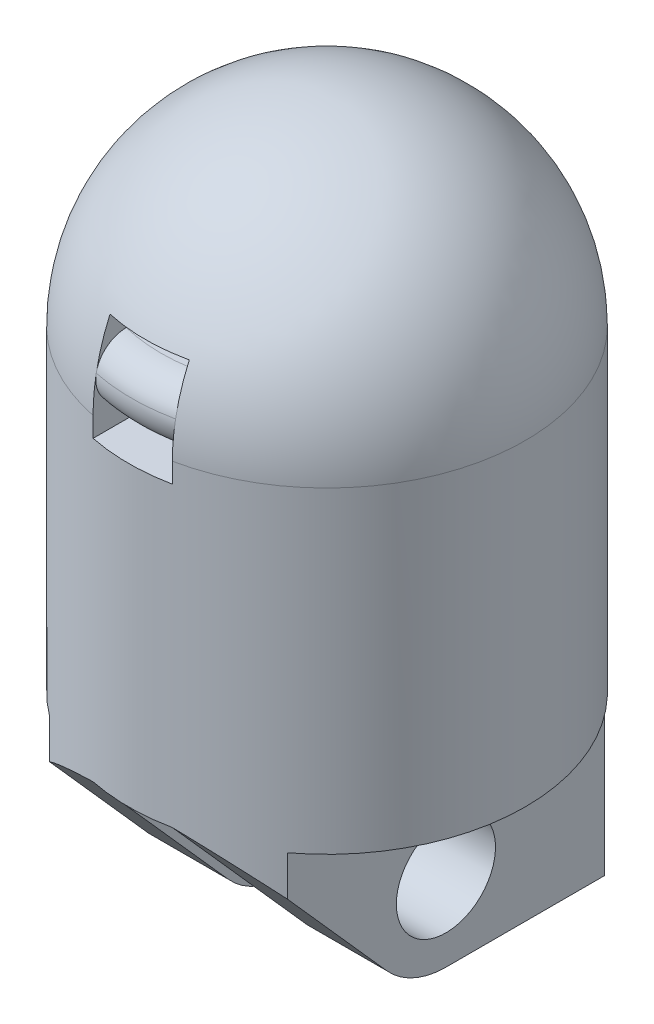
from build123d import *

# Parameters (mm, degrees)
CUT_EXTRUDE1_DEPTH      = 11.43
SKETCH3_R               = 3.175
CUT_EXTRUDE2_DEPTH      = 51.497474194
CUT_EXTRUDE3_DEPTH      = 48.941448664
CUT_EXTRUDE3_DEPTH_BACK = 48.941448664
SKETCH4_W               = 5.08
SKETCH4_H               = 1.27
FILLET1_R               = 1.905


with BuildPart() as part:
    # Sketch1 → Revolve1 (revolve)
    with BuildSketch(Plane.XY, mode=Mode.PRIVATE) as revolve1_sk:
        with BuildLine():
            Line((0, 0), (0, 5.602635041))
            Line((0, 5.602635041), (-2.54, 5.602635041))
            Line((-2.54, 5.602635041), (-2.54, 36.83))
            Line((-2.54, 36.83), (0, 36.83))
            Line((0, 36.83), (0, 44.45))
            ThreePointArc((0, 44.45), (-8.980256121, 40.730256121), (-12.7, 31.75))
            Line((-12.7, 31.75), (-12.7, 0))
            Line((-12.7, 0), (0, 0))
        make_face()
    revolve(revolve1_sk.sketch.rotate(Axis((0, 0, 0), (0, 1, 0)), 270), axis=Axis((0, 0, 0), (0, 1, 0)))

    # Sketch2 → Cut-Extrude1 (cut)
    with BuildSketch(Plane.XZ):
        with BuildLine():
            Line((-2.54, 12.443407893), (-2.54, -12.443407893))
            ThreePointArc((-2.54, -12.443407893), (0, -12.7), (2.54, -12.443407893))
            Line((2.54, -12.443407893), (2.54, 12.443407893))
            ThreePointArc((2.54, 12.443407893), (0, 12.7), (-2.54, 12.443407893))
        make_face()
        with BuildLine():
            Line((-7.62, 10.16), (-7.62, -10.16))
            ThreePointArc((-7.62, -10.16), (-12.7, 0), (-7.62, 10.16))
        make_face()
        with BuildLine():
            Line((7.62, 10.16), (7.62, -10.16))
            ThreePointArc((7.62, -10.16), (12.7, 0), (7.62, 10.16))
        make_face()
    extrude(amount=-CUT_EXTRUDE1_DEPTH, mode=Mode.SUBTRACT)

    # Sketch3 → Cut-Extrude2 (cut, through all)
    with BuildSketch(Plane.ZY.offset(7.62)):
        with Locations((0, 5.08)):
            Circle(SKETCH3_R)
        with BuildLine():
            Line((0, 0), (12.443407893, 0))
            Line((12.443407893, 0), (12.443407893, 11.43))
            Line((12.443407893, 11.43), (3.796422114, 1.704562379))
            ThreePointArc((3.796422114, 1.704562379), (2.080766311, 0.445691901), (0, 0))
        make_face()
    extrude(amount=-CUT_EXTRUDE2_DEPTH, mode=Mode.SUBTRACT)

    # Sketch4 → Cut-Extrude3 (cut, two sides: drawn at the far end of the back side and taken through both)
    with BuildSketch(Plane.XY.offset(-CUT_EXTRUDE3_DEPTH_BACK)):
        with Locations((0, 31.115)):
            Rectangle(SKETCH4_W, SKETCH4_H)
        with Locations((0, 36.195)):
            Rectangle(SKETCH4_W, SKETCH4_H)
    extrude(amount=CUT_EXTRUDE3_DEPTH + CUT_EXTRUDE3_DEPTH_BACK, mode=Mode.SUBTRACT)

    # Fillet1
    # the kernel refuses this fillet: 1.905 mm, written as the material it takes off along each edge
    with BuildSketch(Plane(origin=(0, 31.75, 0), x_dir=(-0.6006287696946434, 0, 0.7995280364159214), z_dir=(-0.7995280364159214, 0, -0.6006287696946434))) as fillet1_piece_1_section:
        with BuildLine():
            CenterArc((10.625582337, 1.905), FILLET1_R, 270, 100.164248622)
            Line((10.625582337, 0), (12.7, 0))
            ThreePointArc((12.7, 0), (12.650073138, 1.125010933), (12.500685102, 2.241176471))
        make_face()
    fillet1_piece_1 = revolve(axis=Axis((0, 31.75, 0), (0, 1, 0)), revolution_arc=73.829886486, mode=Mode.PRIVATE)
    fillet1_piece_1 = split(fillet1_piece_1, bisect_by=Plane(origin=(-2.54, 32.266908465, 12.1243087), z_dir=(1, 0, 0)), keep=Keep.TOP, mode=Mode.PRIVATE)
    fillet1_piece_1 = split(fillet1_piece_1, bisect_by=Plane(origin=(2.54, 32.266908465, 12.1243087), z_dir=(-1, 0, 0)), keep=Keep.TOP, mode=Mode.PRIVATE)
    add(fillet1_piece_1, mode=Mode.SUBTRACT)
    with BuildSketch(Plane(origin=(0, 35.56, 0), x_dir=(0.5180820301307622, 0, 0.8553309359865267), z_dir=(0.8553309359865267, 0, -0.5180820301307622))) as fillet1_piece_2_section:
        with BuildLine():
            CenterArc((10.625582337, 1.905), FILLET1_R, 270, 79.835751378)
            Line((10.625582337, 0), (12.115027858, 0))
            ThreePointArc((12.115027858, 0), (12.332827452, 0.778273257), (12.500685102, 1.568823529))
        make_face()
    fillet1_piece_2 = revolve(axis=Axis((0, 35.56, 0), (0, -1, 0)), revolution_arc=62.407371172, mode=Mode.PRIVATE)
    fillet1_piece_2 = split(fillet1_piece_2, bisect_by=Plane(origin=(-2.54, 35.21222625, 11.799196002), z_dir=(1, 0, 0)), keep=Keep.TOP, mode=Mode.PRIVATE)
    fillet1_piece_2 = split(fillet1_piece_2, bisect_by=Plane(origin=(2.54, 35.21222625, 11.799196002), z_dir=(-1, 0, 0)), keep=Keep.TOP, mode=Mode.PRIVATE)
    add(fillet1_piece_2, mode=Mode.SUBTRACT)
    with BuildSketch(Plane(origin=(0, 35.56, 0), x_dir=(0, 0, -1), z_dir=(-1, 0, 0))) as fillet1_piece_3_section:
        with BuildLine():
            CenterArc((10.625582337, 1.905), FILLET1_R, 270, 79.835751378)
            Line((10.625582337, 0), (12.115027858, 0))
            ThreePointArc((12.115027858, 0), (12.332827452, 0.778273257), (12.500685102, 1.568823529))
        make_face()
    fillet1_piece_3 = revolve(axis=Axis((0, 35.56, 0), (0, -1, 0)), revolution_arc=31.203269463, mode=Mode.PRIVATE)
    fillet1_piece_3 = split(fillet1_piece_3, bisect_by=Plane(origin=(2.54, 35.212226268, -11.799195909), z_dir=(-1, 0, 0)), keep=Keep.TOP, mode=Mode.PRIVATE)
    add(fillet1_piece_3, mode=Mode.SUBTRACT)
    with BuildSketch(Plane(origin=(0, 31.75, 0), x_dir=(0, 0, -1), z_dir=(1, 0, 0))) as fillet1_piece_4_section:
        with BuildLine():
            CenterArc((10.625582337, 1.905), FILLET1_R, 270, 100.164248622)
            Line((10.625582337, 0), (12.7, 0))
            ThreePointArc((12.7, 0), (12.650073138, 1.125010933), (12.500685102, 2.241176471))
        make_face()
    fillet1_piece_4 = revolve(axis=Axis((0, 31.75, 0), (0, 1, 0)), revolution_arc=36.914440828, mode=Mode.PRIVATE)
    fillet1_piece_4 = split(fillet1_piece_4, bisect_by=Plane(origin=(-2.54, 32.26690841, -12.124308672), z_dir=(1, 0, 0)), keep=Keep.TOP, mode=Mode.PRIVATE)
    add(fillet1_piece_4, mode=Mode.SUBTRACT)
    with BuildSketch(Plane(origin=(0, 31.75, 0), x_dir=(0.6006217587640484, 0, -0.799533303183289), z_dir=(0.799533303183289, 0, 0.6006217587640484))) as fillet1_piece_5_section:
        with BuildLine():
            CenterArc((10.625582337, 1.905), FILLET1_R, 270, 100.164248622)
            Line((10.625582337, 0), (12.7, 0))
            ThreePointArc((12.7, 0), (12.650073138, 1.125010933), (12.500685102, 2.241176471))
        make_face()
    fillet1_piece_5 = revolve(axis=Axis((0, 31.75, 0), (0, 1, 0)), revolution_arc=36.914440828, mode=Mode.PRIVATE)
    fillet1_piece_5 = split(fillet1_piece_5, bisect_by=Plane(origin=(2.54, 32.266908503, -12.124308915), z_dir=(-1, 0, 0)), keep=Keep.TOP, mode=Mode.PRIVATE)
    add(fillet1_piece_5, mode=Mode.SUBTRACT)
    with BuildSketch(Plane(origin=(0, 35.56, 0), x_dir=(-0.5180758180945625, 0, -0.8553346986447177), z_dir=(-0.8553346986447177, 0, 0.5180758180945625))) as fillet1_piece_6_section:
        with BuildLine():
            CenterArc((10.625582337, 1.905), FILLET1_R, 270, 79.835751378)
            Line((10.625582337, 0), (12.115027858, 0))
            ThreePointArc((12.115027858, 0), (12.332827452, 0.778273257), (12.500685102, 1.568823529))
        make_face()
    fillet1_piece_6 = revolve(axis=Axis((0, 35.56, 0), (0, -1, 0)), revolution_arc=31.203269463, mode=Mode.PRIVATE)
    fillet1_piece_6 = split(fillet1_piece_6, bisect_by=Plane(origin=(-2.54, 35.212226169, -11.799196271), z_dir=(1, 0, 0)), keep=Keep.TOP, mode=Mode.PRIVATE)
    add(fillet1_piece_6, mode=Mode.SUBTRACT)


solid = part.part
